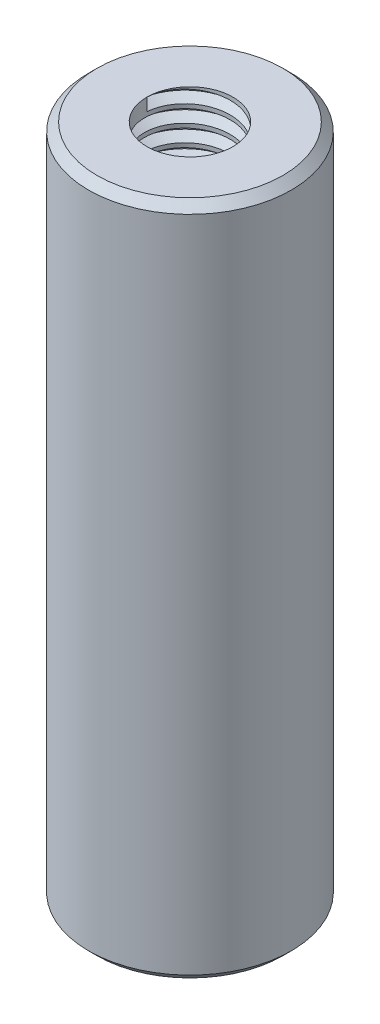
from build123d import *
from build123d.topology import SkipClean

# Parameters (mm, degrees)
CROQUIS2_R              = 4.7625
SALIENTE_EXTRUIR1_DEPTH = 15.875
CHAFL_N1_SIZE           = 0.396875
TAP_START               = 15.875
CROQUIS3_R              = 2.0193
TAP_HOLE_1_DEPTH        = 12.7
TAP_START_2             = -3.175
CROQUIS3_2_R            = 2.0193
TAP_HOLE_2_DEPTH        = 12.7
ROSCA1_PITCH            = 0.79375
ROSCA2_PITCH            = 0.79375


with BuildPart() as part:
    # Croquis2 → Saliente-Extruir1 (new, symmetric)
    with BuildSketch(Plane(origin=(0, 0, 0), x_dir=(1, 0, 0), z_dir=(0, 1, 0))):
        with Locations(Location((0, 0, 0), (0, 0, 270))):
            Circle(CROQUIS2_R)
    extrude(amount=SALIENTE_EXTRUIR1_DEPTH, both=True)

    # Chaflán1
    chafl_n1_edges = [part.edges().sort_by_distance(p)[0] for p in [
        (0, -15.875, -4.7625),
        (0, 15.875, -4.7625),
    ]]
    chamfer(chafl_n1_edges, length=CHAFL_N1_SIZE)

    # Croquis3 → Tap Hole 1 (cut)
    with BuildSketch(Plane(origin=(0, 0, 0), x_dir=(1, 0, 0), z_dir=(0, 1, 0)).offset(TAP_START)):
        with Locations(Location((0, 0, 0), (0, 0, 270))):
            Circle(CROQUIS3_R)
    extrude(amount=-TAP_HOLE_1_DEPTH, mode=Mode.SUBTRACT)

    # Croquis3<2> → Tap Hole 2 (cut)
    with BuildSketch(Plane(origin=(0, 0, 0), x_dir=(1, 0, 0), z_dir=(0, 1, 0)).offset(TAP_START_2)):
        with Locations(Location((0, 0, 0), (0, 0, 270))):
            Circle(CROQUIS3_2_R)
    extrude(amount=-TAP_HOLE_2_DEPTH, mode=Mode.SUBTRACT)

    # Rosca1: the profile of Perfil de rosca2 profile screwed along a right-hand helix of 16 turns, 8 arcs to a turn; built about Z, then put on its axis
    with SkipClean():  # the faces are left unmerged after this step: merging them gives an invalid solid
        rosca1_z = Axis((0, 0, 0), (0, 0, 1))
        rosca1_corners = [(2.019, 0, -0.000173205), (2.448929788, 0, 0.248046874), (2.448929788, 0, 0.347265624), (2.019, 0, 0.595485703)]
        with BuildLine(mode=Mode.PRIVATE) as rosca1_profile:
            Line(rosca1_corners[0], rosca1_corners[1])
            Line(rosca1_corners[1], rosca1_corners[2])
            Line(rosca1_corners[2], rosca1_corners[3])
            Line(rosca1_corners[3], rosca1_corners[0])
        rosca1_cap = Face(rosca1_profile.wire())
        rosca1_turn_angles = [0, 22.5, 45, 67.5, 90, 112.5, 135, 157.5, 180, 202.5, 225, 247.5, 270, 292.5, 315, 337.5, 360]
        rosca1_turn_weights = [1, 0.9238795325112867, 1, 0.9238795325112867, 1, 0.9238795325112867, 1, 0.9238795325112867, 1, 0.9238795325112867, 1, 0.9238795325112867, 1, 0.9238795325112867, 1, 0.9238795325112867, 1]
        rosca1_turn_rails = [Edge.make_bspline([Vector(p[0], p[1], 0).rotate(rosca1_z, rosca1_turn_angles[k]) / rosca1_turn_weights[k] + Vector(0, 0, p[2] + ROSCA1_PITCH * rosca1_turn_angles[k] / 360) for k in range(17)], [0, 0, 0, 1, 1, 2, 2, 3, 3, 4, 4, 5, 5, 6, 6, 7, 7, 8, 8, 8], 2, rosca1_turn_weights) for p in rosca1_corners]
        rosca1_turn_sides = [Face.make_surface_from_curves(rosca1_turn_rails[p[0]], rosca1_turn_rails[p[1]]) for p in [(0, 1), (1, 2), (2, 3), (3, 0)]]
        rosca1 = Plane(origin=(0, 15.875, 0), x_dir=(-1, 0, 0), z_dir=(0, -1, 0)) * Solid(Shell([*[p.moved(Location((0, 0, ROSCA1_PITCH * i))) for i in range(16) for p in rosca1_turn_sides], rosca1_cap, rosca1_cap.rotate(rosca1_z, 5760).moved(Location((0, 0, ROSCA1_PITCH * 5760 / 360)))]))
        add(rosca1, mode=Mode.SUBTRACT)

    # Rosca2: the profile of Perfil de rosca3 profile screwed along a right-hand helix of 16 turns, 8 arcs to a turn; built about Z, then put on its axis
    with SkipClean():  # the faces are left unmerged after this step: merging them gives an invalid solid
        rosca2_z = Axis((0, 0, 0), (0, 0, 1))
        rosca2_corners = [(2.019, 0, -0.000173205), (2.448929788, 0, 0.248046874), (2.448929788, 0, 0.347265624), (2.019, 0, 0.595485703)]
        with BuildLine(mode=Mode.PRIVATE) as rosca2_profile:
            Line(rosca2_corners[0], rosca2_corners[1])
            Line(rosca2_corners[1], rosca2_corners[2])
            Line(rosca2_corners[2], rosca2_corners[3])
            Line(rosca2_corners[3], rosca2_corners[0])
        rosca2_cap = Face(rosca2_profile.wire())
        rosca2_turn_angles = [0, 22.5, 45, 67.5, 90, 112.5, 135, 157.5, 180, 202.5, 225, 247.5, 270, 292.5, 315, 337.5, 360]
        rosca2_turn_weights = [1, 0.9238795325112867, 1, 0.9238795325112867, 1, 0.9238795325112867, 1, 0.9238795325112867, 1, 0.9238795325112867, 1, 0.9238795325112867, 1, 0.9238795325112867, 1, 0.9238795325112867, 1]
        rosca2_turn_rails = [Edge.make_bspline([Vector(p[0], p[1], 0).rotate(rosca2_z, rosca2_turn_angles[k]) / rosca2_turn_weights[k] + Vector(0, 0, p[2] + ROSCA2_PITCH * rosca2_turn_angles[k] / 360) for k in range(17)], [0, 0, 0, 1, 1, 2, 2, 3, 3, 4, 4, 5, 5, 6, 6, 7, 7, 8, 8, 8], 2, rosca2_turn_weights) for p in rosca2_corners]
        rosca2_turn_sides = [Face.make_surface_from_curves(rosca2_turn_rails[p[0]], rosca2_turn_rails[p[1]]) for p in [(0, 1), (1, 2), (2, 3), (3, 0)]]
        rosca2 = Plane(origin=(0, -15.875, 0), x_dir=(1, 0, 0), z_dir=(0, 1, 0)) * Solid(Shell([*[p.moved(Location((0, 0, ROSCA2_PITCH * i))) for i in range(16) for p in rosca2_turn_sides], rosca2_cap, rosca2_cap.rotate(rosca2_z, 5760).moved(Location((0, 0, ROSCA2_PITCH * 5760 / 360)))]))
        add(rosca2, mode=Mode.SUBTRACT)


solid = part.part
